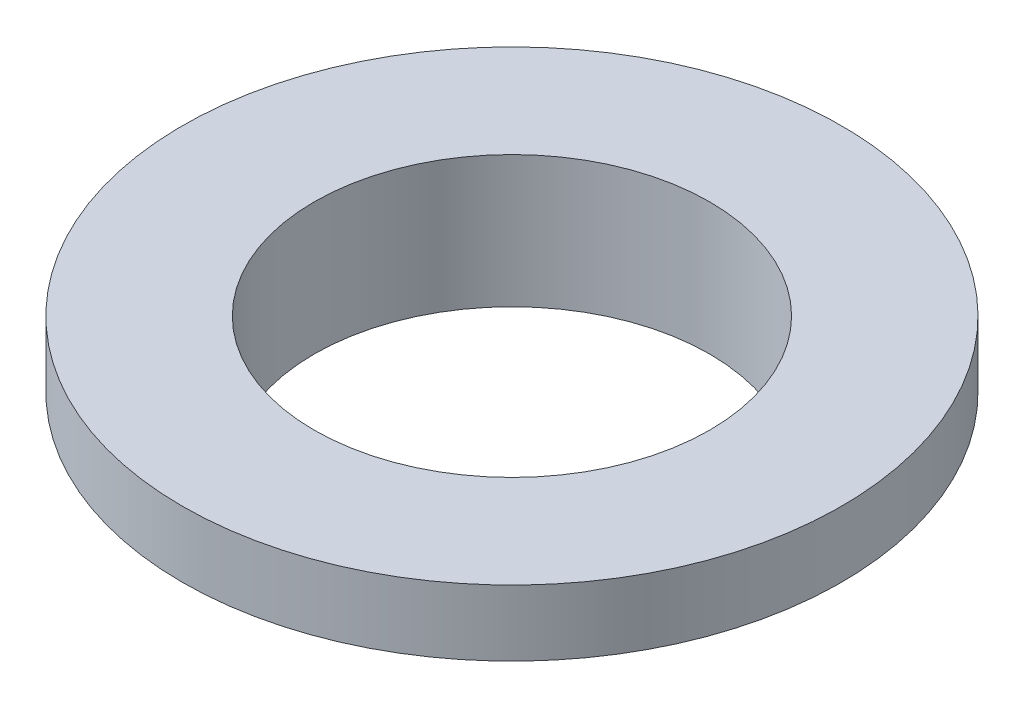
from build123d import *

# Parameters (mm, degrees)
SKETCH1_R               = 50
SKETCH1_R_2             = 30
BOSS_EXTRUDE1_DEPTH     = 10
SKETCH2_R               = 32.45
BOSS_EXTRUDE2_DEPTH     = 30
SKETCH3_R               = 30
CUT_EXTRUDE1_DEPTH      = 77.811457479
THREAD1_PITCH           = 3
CUT_EXTRUDE2_DEPTH      = 50
CUT_EXTRUDE2_DEPTH_BACK = 50
SKETCH6_W               = 71.894010552
SKETCH6_H               = 22


with BuildPart() as part:
    # Sketch1 → Boss-Extrude1 (new body)
    with BuildSketch(Plane(origin=(0, 0, 0), x_dir=(1, 0, 0), z_dir=(0, 1, 0))):
        with Locations(Location((0, 0, 0), (0, 0, 270))):
            Circle(SKETCH1_R)
        with Locations(Location((0, 0, 0), (0, 0, 270))):
            Circle(SKETCH1_R_2, mode=Mode.SUBTRACT)
    extrude(amount=BOSS_EXTRUDE1_DEPTH)

    # Sketch2 → Boss-Extrude2 (add)
    with BuildSketch(Plane.XZ):
        with Locations(Location((0, 0, 0), (0, 0, 90))):
            Circle(SKETCH2_R)
    extrude(amount=BOSS_EXTRUDE2_DEPTH)

    # Sketch3 → Cut-Extrude1 (cut, through all)
    with BuildSketch(Plane(origin=(0, 0, 0), x_dir=(1, 0, 0), z_dir=(0, 1, 0))):
        with Locations(Location((0, 0, 0), (0, 0, 270))):
            Circle(SKETCH3_R)
    extrude(amount=-CUT_EXTRUDE1_DEPTH, mode=Mode.SUBTRACT)

    # Thread1: the profile of Thread Profile1 profile screwed along a right-hand helix of 10 turns, 10 arcs to a turn; built about Z, then put on its axis
    thread1_z = Axis((0, 0, 0), (0, 0, 1))
    thread1_corners = [(32.4503, 0, -0.000173205), (32.4503, 0, 2.625173197), (30.826202375, 0, 1.687499996), (30.826202375, 0, 0.937499996)]
    with BuildLine(mode=Mode.PRIVATE) as thread1_profile:
        Line(thread1_corners[0], thread1_corners[1])
        Line(thread1_corners[1], thread1_corners[2])
        Line(thread1_corners[2], thread1_corners[3])
        Line(thread1_corners[3], thread1_corners[0])
    thread1_cap = Face(thread1_profile.wire())
    thread1_turn_angles = [0, 18, 36, 54, 72, 90, 108, 126, 144, 162, 180, 198, 216, 234, 252, 270, 288, 306, 324, 342, 360]
    thread1_turn_weights = [1, 0.9510565162951535, 1, 0.9510565162951535, 1, 0.9510565162951535, 1, 0.9510565162951535, 1, 0.9510565162951535, 1, 0.9510565162951535, 1, 0.9510565162951535, 1, 0.9510565162951535, 1, 0.9510565162951535, 1, 0.9510565162951535, 1]
    thread1_turn_rails = [Edge.make_bspline([Vector(p[0], p[1], 0).rotate(thread1_z, thread1_turn_angles[k]) / thread1_turn_weights[k] + Vector(0, 0, p[2] + THREAD1_PITCH * thread1_turn_angles[k] / 360) for k in range(21)], [0, 0, 0, 1, 1, 2, 2, 3, 3, 4, 4, 5, 5, 6, 6, 7, 7, 8, 8, 9, 9, 10, 10, 10], 2, thread1_turn_weights) for p in thread1_corners]
    thread1_turn_sides = [Face.make_surface_from_curves(thread1_turn_rails[p[0]], thread1_turn_rails[p[1]]) for p in [(0, 1), (1, 2), (2, 3), (3, 0)]]
    thread1 = Plane(origin=(0, -30, 0), x_dir=(1, 0, 0), z_dir=(0, 1, 0)) * Solid(Shell([*[p.moved(Location((0, 0, THREAD1_PITCH * i))) for i in range(10) for p in thread1_turn_sides], thread1_cap, thread1_cap.rotate(thread1_z, 3600).moved(Location((0, 0, THREAD1_PITCH * 3600 / 360)))]))
    add(thread1, mode=Mode.SUBTRACT)

    # Sketch6 → Cut-Extrude2 (cut, two sides: drawn at the far end of the back side and taken through both)
    with BuildSketch(Plane(origin=(0, 0, 0), x_dir=(0, 0, -1), z_dir=(1, 0, 0)).offset(-CUT_EXTRUDE2_DEPTH_BACK)):
        with Locations((-0.745567517, -21)):
            Rectangle(SKETCH6_W, SKETCH6_H)
    extrude(amount=CUT_EXTRUDE2_DEPTH + CUT_EXTRUDE2_DEPTH_BACK, mode=Mode.SUBTRACT)


solid = part.part
